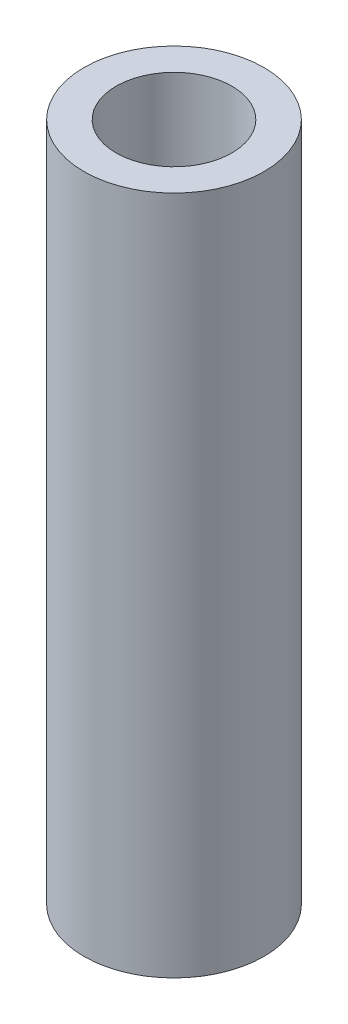
from build123d import *

# Parameters (mm, degrees)
SKETCH1_R           = 3.873
SKETCH1_R_2         = 2.4892
BOSS_EXTRUDE1_DEPTH = 29.224986


with BuildPart() as part:
    # Sketch1 → Boss-Extrude1 (new body)
    with BuildSketch(Plane(origin=(0, 0, 0), x_dir=(1, 0, 0), z_dir=(0, 1, 0))):
        Circle(SKETCH1_R)
        Circle(SKETCH1_R_2, mode=Mode.SUBTRACT)
    extrude(amount=BOSS_EXTRUDE1_DEPTH)


solid = part.part
